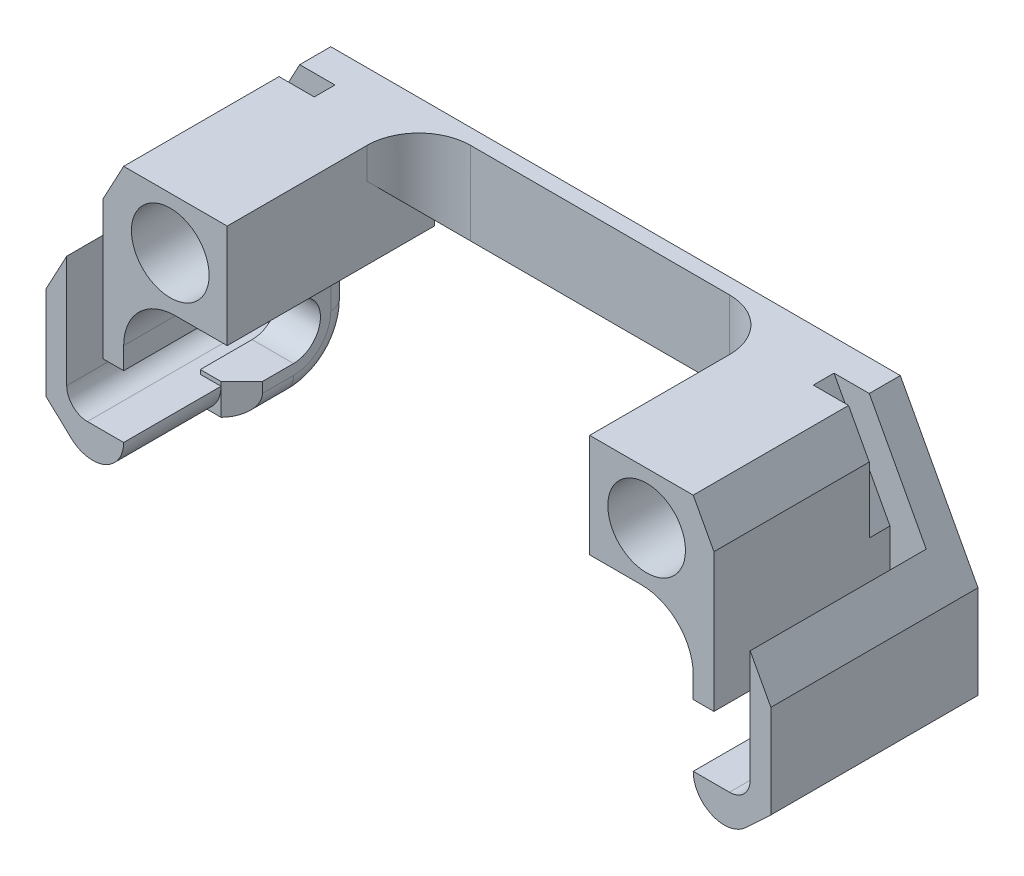
from build123d import *

# Parameters (mm, degrees)
BOSS_EXTRUDE1_DEPTH = 20
SKETCH3_W           = 35
SKETCH3_H           = 18.5
CUT_EXTRUDE2_DEPTH  = 44.406131606
CUT_EXTRUDE1_DEPTH  = 17
SKETCH5_R           = 1.75
CUT_EXTRUDE4_DEPTH  = 44.406131606
SKETCH6_R           = 3.75
CUT_EXTRUDE5_DEPTH  = 7
CHAMFER1_SIZE       = 2
FILLET1_R           = 5
BOSS_EXTRUDE5_DEPTH = 2
CHAMFER2_SIZE       = 2
FILLET2_R           = 2
SKETCH8_W           = 2
SKETCH8_H           = 17.504208533
CUT_EXTRUDE6_DEPTH  = 3


# Some blends are built 0.0001 mm under size
with BuildPart() as part:
    # Sketch1 → Boss-Extrude1 (new body)
    with BuildSketch(Plane.XY):
        with BuildLine():
            Line((-22.5, 0), (22.5, 0))
            ThreePointArc((22.5, 0), (26.035533906, -1.464466094), (27.5, -5))
            Line((27.5, -5), (27.5, -13.096343094))
            ThreePointArc((27.5, -13.096343094), (29.304354621, -15.847784921), (32.546954751, -15.289508899))
            Line((32.546954751, -15.289508899), (35, -13))
            Line((35, -13), (35, -4))
            Line((35, -4), (27.5, 10))
            Line((27.5, 10), (-27.5, 10))
            Line((-27.5, 10), (-35, -4))
            Line((-35, -4), (-35, -13))
            Line((-35, -13), (-32.546954751, -15.289508899))
            ThreePointArc((-32.546954751, -15.289508899), (-29.304354621, -15.847784921), (-27.5, -13.096343094))
            Line((-27.5, -13.096343094), (-27.5, -5))
            ThreePointArc((-27.5, -5), (-26.035533906, -1.464466094), (-22.5, 0))
        make_face()
    extrude(amount=BOSS_EXTRUDE1_DEPTH)

    # Sketch3 → Cut-Extrude2 (cut, through all)
    with BuildSketch(Plane.XZ):
        with Locations((0, 10.75)):
            Rectangle(SKETCH3_W, SKETCH3_H)
    extrude(amount=-CUT_EXTRUDE2_DEPTH, mode=Mode.SUBTRACT)

    # Sketch2 → Cut-Extrude1 (cut)
    with BuildSketch(Plane.XY.offset(20)):
        with BuildLine():
            Line((-27.5, -13.096343094), (-30.529524623, -13.096343094))
            Line((-30.529524623, -13.096343094), (-31, -13.096343094))
            ThreePointArc((-31, -13.096343094), (-32.414213562, -12.510556657), (-33, -11.096343094))
            Line((-33, -11.096343094), (-33, 8.594773791))
            Line((-33, 8.594773791), (-29.5, 8.594773791))
            Line((-29.5, 8.594773791), (-29.5, -7.096343094))
            Line((-29.5, -7.096343094), (-27.5, -7.096343094))
            Line((-27.5, -7.096343094), (-27.5, -13.096343094))
        make_face()
    cut_extrude1 = extrude(amount=-CUT_EXTRUDE1_DEPTH, mode=Mode.SUBTRACT)

    # Mirror1: Cut-Extrude1 across plane
    add(cut_extrude1.mirror(Plane(origin=(0, 0, 0), x_dir=(0, 0, 1), z_dir=(1, 0, 0))), mode=Mode.SUBTRACT)

    # Sketch5 → Cut-Extrude4 (cut, through all)
    with BuildSketch(Plane.XY.offset(20)):
        with Locations((-23, 5)):
            Circle(SKETCH5_R)
        with Locations((23, 5)):
            Circle(SKETCH5_R)
    extrude(amount=-CUT_EXTRUDE4_DEPTH, mode=Mode.SUBTRACT)

    # Sketch6 → Cut-Extrude5 (cut)
    with BuildSketch(Plane.XY.offset(20)):
        with Locations((-23, 5)):
            Circle(SKETCH6_R)
        with Locations((23, 5)):
            Circle(SKETCH6_R)
    extrude(amount=-CUT_EXTRUDE5_DEPTH, mode=Mode.SUBTRACT)

    # Chamfer1
    # the kernel refuses this chamfer: 2 mm, written as the material it takes off along each edge
    with BuildSketch(Plane(origin=(17.5, 0, 1.5), x_dir=(0, -0.027495876610586365, -0.9996219169112968), z_dir=(-1, 0, 0))) as chamfer1_piece_1:
        Polygon((CHAMFER1_SIZE * 0.999621916911, -CHAMFER1_SIZE * 0.0274958766106), (-CHAMFER1_SIZE * 0.0274958766106, -CHAMFER1_SIZE * 0.999621916911), (0, 0), align=None)
    extrude(amount=35, mode=Mode.SUBTRACT)

    # Fillet1
    fillet1_edges = [part.edges().sort_by_distance(p)[0] for p in [
        (-17.5, 6, 1.5),
        (17.5, 6, 1.5),
    ]]
    fillet(fillet1_edges, radius=FILLET1_R)

    # Sketch7 → Boss-Extrude5 (add, symmetric)
    with BuildSketch(Plane(origin=(-27.5, 0, 0), x_dir=(0, 0, -1), z_dir=(1, 0, 0))):
        with BuildLine():
            Line((0, -10.096343094), (0, 0))
            Line((0, 0), (-10.6, 0))
            Line((-10.6, 0), (-10.6, -7.496343094))
            Line((-10.6, -7.496343094), (-5.6, -7.496343094))
            ThreePointArc((-5.6, -7.496343094), (-3, -10.096343094), (-5.6, -12.696343094))
            Line((-5.6, -12.696343094), (-10.6, -12.696343094))
            Line((-10.6, -12.696343094), (-10.6, -15.696343094))
            Line((-10.6, -15.696343094), (-5.6, -15.696343094))
            ThreePointArc((-5.6, -15.696343094), (-1.640202025, -14.056141069), (0, -10.096343094))
        make_face()
    boss_extrude5 = extrude(amount=BOSS_EXTRUDE5_DEPTH, both=True)

    # Mirror4: Boss-Extrude5 across plane
    add(boss_extrude5.mirror(Plane(origin=(0, 0, 0), x_dir=(0, 0, 1), z_dir=(1, 0, 0))))

    # Chamfer2
    chamfer2_edges = [part.edges().sort_by_distance(p)[0] for p in [
        (25.5, -14.196343094, 10.6),
        (25.5, -4.248171547, 10.6),
        (-25.5, -4.248171547, 10.6),
        (-25.5, -14.196343094, 10.6),
    ]]
    chamfer(chamfer2_edges, length=CHAMFER2_SIZE - 0.0001)  # a hair under: the kernel refuses the full size

    # Fillet2
    fillet2_edges = [part.edges().sort_by_distance(p)[0] for p in [
        (25.5, -5.548171547, 0),
        (25.5, -14.056141069, 1.640202025),
        (-25.5, -5.548171547, 0),
        (-25.5, -14.056141069, 1.640202025),
        (25.5, -15.696343094, 7.10005),
        (-25.5, -15.696343094, 7.10005),
    ]]
    fillet(fillet2_edges, radius=FILLET2_R - 0.0001)  # a hair under: the kernel refuses the full size

    # Sketch8 → Cut-Extrude6 (cut)
    with BuildSketch(Plane(origin=(-25.530227948, 13.67690783, 0), x_dir=(0, 0, 1), z_dir=(-0.8814799700287818, 0.4722214125154193, 0))):
        with Locations((4, -6.39655042)):
            Rectangle(SKETCH8_W, SKETCH8_H)
    cut_extrude6 = extrude(amount=-CUT_EXTRUDE6_DEPTH, mode=Mode.SUBTRACT)

    # Mirror5: Cut-Extrude6 across plane
    add(cut_extrude6.mirror(Plane(origin=(0, 0, 0), x_dir=(0, 0, 1), z_dir=(1, 0, 0))), mode=Mode.SUBTRACT)


solid = part.part
